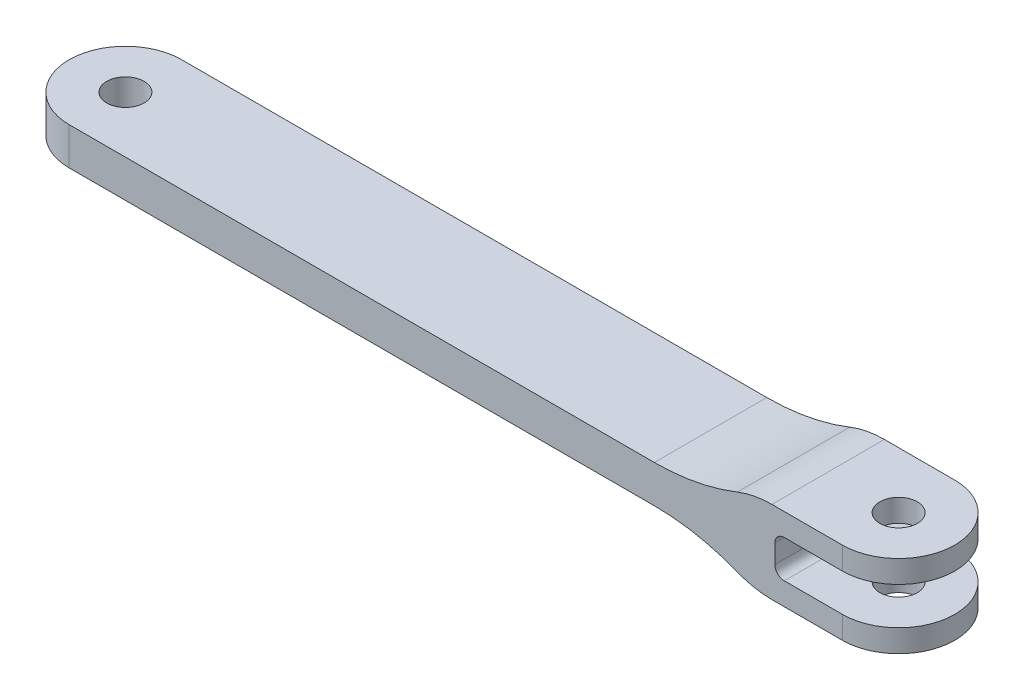
from build123d import *
from build123d.topology import SkipClean

# Parameters (mm, degrees)
SKETCH1_R                = 2.4
BOSS_EXTRUDE1_DEPTH      = 5
BOSS_EXTRUDE2_DEPTH      = 3
BOSS_EXTRUDE2_DEPTH_BACK = 8
SKETCH3_R                = 2.4
CUT_EXTRUDE1_DEPTH       = 2.5
CUT_EXTRUDE1_DEPTH_BACK  = 2.5
SKETCH4_R                = 2.4
FILLET1_R                = 30
SCALE1_SCALE             = 0.8
CUT_EXTRUDE2_DEPTH       = 49.577813504
CUT_EXTRUDE2_DEPTH_BACK  = 49.577813504
SKETCH5_R                = 2
FILLET2_R                = 1
FILLET3_R                = 10


with BuildPart() as part:
    # Sketch1 → Boss-Extrude1 (new body)
    with BuildSketch(Plane(origin=(0, 0, 0), x_dir=(1, 0, 0), z_dir=(0, 1, 0))):
        with BuildLine():
            Line((-51.5565916, 7.5), (51.5565916, 7.5))
            ThreePointArc((51.5565916, 7.5), (59.0565916, 0), (51.5565916, -7.5))
            Line((51.5565916, -7.5), (-51.5565916, -7.5))
            ThreePointArc((-51.5565916, -7.5), (-59.0565916, 0), (-51.5565916, 7.5))
        make_face()
        with Locations(Location((-51.5565916, 0, 0), (0, 0, 270))):
            Circle(SKETCH1_R, mode=Mode.SUBTRACT)
        with Locations(Location((51.5565916, 0, 0), (0, 0, 270))):
            Circle(SKETCH1_R, mode=Mode.SUBTRACT)
    extrude(amount=BOSS_EXTRUDE1_DEPTH)

    # Sketch3 → Boss-Extrude2 (add, two sides: drawn at the far end of the back side and taken through both)
    with SkipClean():  # the faces are left unmerged after this step: merging them gives an invalid solid
        with BuildSketch(Plane(origin=(0, 5, 0), x_dir=(1, 0, 0), z_dir=(0, 1, 0)).offset(-BOSS_EXTRUDE2_DEPTH_BACK)):
            with BuildLine():
                Line((51.5565916, 7.5), (39.5565916, 7.5))
                Line((39.5565916, 7.5), (39.5565916, -7.5))
                Line((39.5565916, -7.5), (51.5565916, -7.5))
                ThreePointArc((51.5565916, -7.5), (59.0565916, 0), (51.5565916, 7.5))
            make_face()
            with Locations(Location((51.5565916, 0, 0), (0, 0, 270))):
                Circle(SKETCH3_R, mode=Mode.SUBTRACT)
        extrude(amount=BOSS_EXTRUDE2_DEPTH + BOSS_EXTRUDE2_DEPTH_BACK)
    add(part.part.scale(1), mode=Mode.REPLACE)  # the faces are merged on a copy

    # Sketch4 → Cut-Extrude1 (cut, two sides: drawn at the far end of the back side and taken through both)
    with BuildSketch(Plane(origin=(0, 2.5, 0), x_dir=(1, 0, 0), z_dir=(0, 1, 0)).offset(-CUT_EXTRUDE1_DEPTH_BACK)):
        with BuildLine():
            Line((42.5565916, 7.5), (42.5565916, -7.5))
            Line((42.5565916, -7.5), (51.5565916, -7.5))
            ThreePointArc((51.5565916, -7.5), (59.0565916, 0), (51.5565916, 7.5))
            Line((51.5565916, 7.5), (42.5565916, 7.5))
        make_face()
        with Locations(Location((51.5565916, 0, 0), (0, 0, 270))):
            Circle(SKETCH4_R, mode=Mode.SUBTRACT)
    extrude(amount=CUT_EXTRUDE1_DEPTH + CUT_EXTRUDE1_DEPTH_BACK, mode=Mode.SUBTRACT)

    # Fillet1
    # the kernel refuses this fillet: 30 mm, written as the material it adds along each edge
    with BuildSketch(Plane(origin=(39.5565916, 0, -7.5), x_dir=(0, -1, 0), z_dir=(0, 0, 1))) as fillet1_piece_1:
        with BuildLine():
            CenterArc((30, -13.076696831), FILLET1_R, 154.158067237, 25.841932763)
            Line((0, -13.076696831), (-0.6, -13.076696831))
            Line((-0.6, -13.076696831), (-0.6, 0))
            Line((-0.6, 0), (0, 0.6))
            ThreePointArc((0, 0.6), (1.5, 0.6), (2.46, 0.261533937))
            Line((2.46, 0.261533937), (3, 0))
        make_face()
    extrude(amount=15)
    with BuildSketch(Plane(origin=(39.5565916, 5, -7.5), x_dir=(-1, 0, 0), z_dir=(0, 0, 1))) as fillet1_piece_2:
        with BuildLine():
            CenterArc((13.076696831, -30), FILLET1_R, 90, 25.841932763)
            Line((0, -3), (-0.261533937, -2.46))
            ThreePointArc((-0.261533937, -2.46), (-0.6, -1.5), (-0.6, 0))
            Line((-0.6, 0), (0, 0.6))
            Line((0, 0.6), (13.076696831, 0.6))
            Line((13.076696831, 0.6), (13.076696831, 0))
        make_face()
    extrude(amount=15)


with BuildPart() as part_1:
    # Scale1: scaled about (3.796755654, 2.5, 0)
    add(part.part.scale(SCALE1_SCALE).moved(Location((0.759351131, 0.5, 0))))

    # Sketch5 → Cut-Extrude2 (cut, two sides: drawn at the far end of the back side and taken through both)
    with BuildSketch(Plane(origin=(0, 2.5, 0), x_dir=(1, 0, 0), z_dir=(0, 1, 0)).offset(-CUT_EXTRUDE2_DEPTH_BACK)):
        with Locations(Location((-40.485922149, 0, 0), (0, 0, 270))):
            Circle(SKETCH5_R)
        with Locations(Location((42.004624411, 0, 0), (0, 0, 270))):
            Circle(SKETCH5_R)
    extrude(amount=CUT_EXTRUDE2_DEPTH + CUT_EXTRUDE2_DEPTH_BACK, mode=Mode.SUBTRACT)

    # Fillet2
    fillet2_edges = [part_1.edges().sort_by_distance(p)[0] for p in [
        (34.804624411, 4.5, 0),
        (34.804624411, 0.5, 0),
    ]]
    fillet(fillet2_edges, radius=FILLET2_R)

    # Fillet3
    fillet3_edges = [part_1.edges().sort_by_distance(p)[0] for p in [
        (32.404624411, -1.9, 0),
        (32.404624411, 6.9, 0),
    ]]
    fillet(fillet3_edges, radius=FILLET3_R)


solid = part_1.part
